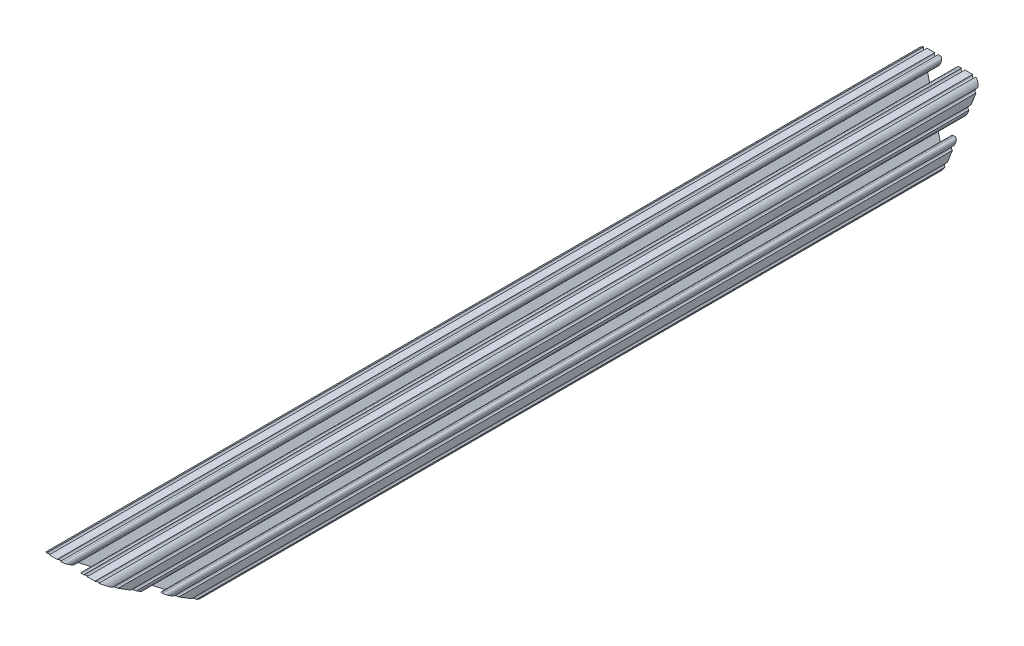
from build123d import *

# Parameters (mm, degrees)
BOSS_EXTRUDE1_DEPTH     = 342.5
CUT_EXTRUDE1_DEPTH      = 344.557935434
CUT_EXTRUDE1_DEPTH_BACK = 344.557935434
SKETCH5_R               = 1.016
CUT_EXTRUDE2_DEPTH      = 346.138758328


with BuildPart() as part:
    # Sketch4 → Boss-Extrude1 (new, symmetric)
    with BuildSketch(Plane.XY):
        with BuildLine():
            Line((5.7912, -19.05), (14.3002, -19.05))
            ThreePointArc((14.3002, -19.05), (17.658815789, -17.658815789), (19.05, -14.3002))
            Line((19.05, -14.3002), (19.05, -5.7912))
            ThreePointArc((19.05, -5.7912), (18.544114832, -4.569885168), (17.3228, -4.064))
            Line((17.3228, -4.064), (16.7132, -4.064))
            ThreePointArc((16.7132, -4.064), (15.491885168, -4.569885168), (14.986, -5.7912))
            Line((14.986, -5.7912), (14.986, -8.996305235))
            ThreePointArc((14.986, -8.996305235), (14.189232738, -10.188751711), (12.782646215, -9.908964256))
            Line((12.782646215, -9.908964256), (7.888897763, -5.015215804))
            ThreePointArc((7.888897763, -5.015215804), (7.219915375, -4.014012907), (6.985, -2.833013566))
            Line((6.985, -2.833013566), (6.985, 0))
            Line((6.985, 0), (3.3274, 0))
            ThreePointArc((3.3274, 0), (2.352827104, -2.352827104), (0, -3.3274))
            Line((0, -3.3274), (0, -6.985))
            Line((0, -6.985), (2.833013566, -6.985))
            ThreePointArc((2.833013566, -6.985), (4.014012907, -7.219915375), (5.015215804, -7.888897763))
            Line((5.015215804, -7.888897763), (9.908964256, -12.782646215))
            ThreePointArc((9.908964256, -12.782646215), (10.188751711, -14.189232738), (8.996305235, -14.986))
            Line((8.996305235, -14.986), (5.7912, -14.986))
            ThreePointArc((5.7912, -14.986), (4.569885168, -15.491885168), (4.064, -16.7132))
            Line((4.064, -16.7132), (4.064, -17.3228))
            ThreePointArc((4.064, -17.3228), (4.569885168, -18.544114832), (5.7912, -19.05))
        make_face()
    extrude(amount=BOSS_EXTRUDE1_DEPTH, both=True)

    # Sketch5 → Cut-Extrude1 (cut, two sides: drawn at the far end of the back side and taken through both)
    with BuildSketch(Plane.XY.offset(-CUT_EXTRUDE1_DEPTH_BACK)):
        with Locations((14.739477062, -19.05)):
            Circle(SKETCH5_R)
        with Locations((7.980305235, -19.05)):
            Circle(SKETCH5_R)
        with Locations((19.05, -14.739477062)):
            Circle(SKETCH5_R)
        with Locations((19.05, -7.980305235)):
            Circle(SKETCH5_R)
    extrude(amount=CUT_EXTRUDE1_DEPTH + CUT_EXTRUDE1_DEPTH_BACK, mode=Mode.SUBTRACT)

    # Mirror1: part across plane


with BuildPart() as part_1:
    add(part.part)
    add(part.part.mirror(Plane(origin=(0, 0, 0), x_dir=(0, 0, 1), z_dir=(1, 0, 0))))

    # Mirror2: part across plane


with BuildPart() as part_2:
    add(part_1.part)
    add(part_1.part.mirror(Plane.ZX))

    # Sketch6 → Cut-Extrude2 (cut, through all)
    with BuildSketch(Plane(origin=(19.05, 0, 0), x_dir=(0, 0, -1), z_dir=(1, 0, 0))):
        Polygon((-342.5, -19.05), (-281.289790268, -19.05), (-342.5, 19.05), align=None)
        Polygon((342.5, 19.05), (184.5, 19.05), (160.784838651, -19.05), (342.5, -19.05), align=None)
    extrude(amount=-CUT_EXTRUDE2_DEPTH, mode=Mode.SUBTRACT)


solid = part_2.part
